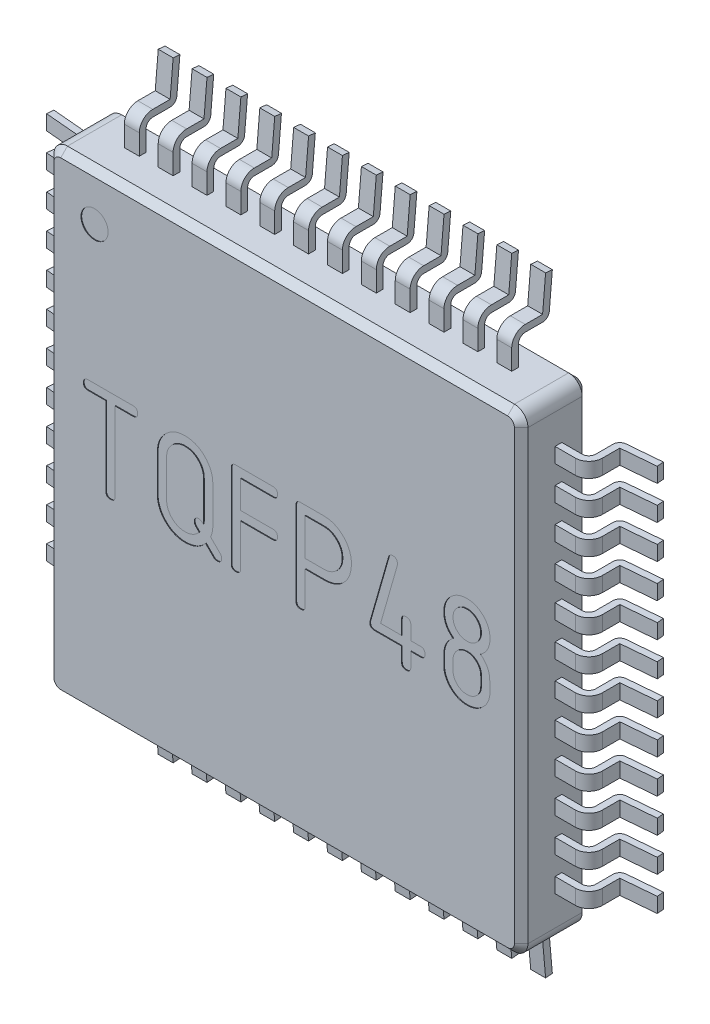
from build123d import *

# Parameters (mm, degrees)
EXTRUDE_1_DEPTH                  = 1
CHAMFER_1_SIZE                   = 0.1
EXTRUDE_2_DEPTH                  = 0.11
PATTERN_LINEAR_1_COUNT           = 12
PATTERN_LINEAR_1_PITCH           = 0.5
PATTERN_CIRCULAR_1_COUNT         = 4
PATTERN_CIRCULAR_1_COPY_1_DEPTH  = 0.11
PATTERN_CIRCULAR_1_COPY_2_DEPTH  = 0.11
PATTERN_CIRCULAR_1_COPY_3_DEPTH  = 0.11
PATTERN_CIRCULAR_1_COPY_4_DEPTH  = 0.11
PATTERN_CIRCULAR_1_COPY_5_DEPTH  = 0.11
PATTERN_CIRCULAR_1_COPY_6_DEPTH  = 0.11
PATTERN_CIRCULAR_1_COPY_7_DEPTH  = 0.11
PATTERN_CIRCULAR_1_COPY_8_DEPTH  = 0.11
PATTERN_CIRCULAR_1_COPY_9_DEPTH  = 0.11
PATTERN_CIRCULAR_1_COPY_10_DEPTH = 0.11
PATTERN_CIRCULAR_1_COPY_11_DEPTH = 0.11
PATTERN_CIRCULAR_1_COPY_12_DEPTH = 0.11
PATTERN_CIRCULAR_1_COPY_13_DEPTH = 0.11
PATTERN_CIRCULAR_1_COPY_14_DEPTH = 0.11
PATTERN_CIRCULAR_1_COPY_15_DEPTH = 0.11
PATTERN_CIRCULAR_1_COPY_16_DEPTH = 0.11
PATTERN_CIRCULAR_1_COPY_17_DEPTH = 0.11
PATTERN_CIRCULAR_1_COPY_18_DEPTH = 0.11
PATTERN_CIRCULAR_1_COPY_19_DEPTH = 0.11
PATTERN_CIRCULAR_1_COPY_20_DEPTH = 0.11
PATTERN_CIRCULAR_1_COPY_21_DEPTH = 0.11
PATTERN_CIRCULAR_1_COPY_22_DEPTH = 0.11
PATTERN_CIRCULAR_1_COPY_23_DEPTH = 0.11
PATTERN_CIRCULAR_1_COPY_24_DEPTH = 0.11
PATTERN_CIRCULAR_1_COPY_25_DEPTH = 0.11
PATTERN_CIRCULAR_1_COPY_26_DEPTH = 0.11
PATTERN_CIRCULAR_1_COPY_27_DEPTH = 0.11
PATTERN_CIRCULAR_1_COPY_28_DEPTH = 0.11
PATTERN_CIRCULAR_1_COPY_29_DEPTH = 0.11
PATTERN_CIRCULAR_1_COPY_30_DEPTH = 0.11
PATTERN_CIRCULAR_1_COPY_31_DEPTH = 0.11
PATTERN_CIRCULAR_1_COPY_32_DEPTH = 0.11
PATTERN_CIRCULAR_1_COPY_33_DEPTH = 0.11
SKETCH_4_R                       = 0.2
CUT_EXTRUDE_1_DEPTH              = 0.01


with BuildPart() as part:
    # Эскиз2 → Бобышка-Вытянуть1 (new body)
    with BuildSketch(Plane.XY.offset(0.1)):
        with BuildLine():
            Line((-3.3, 3.5), (3.3, 3.5))
            ThreePointArc((3.3, 3.5), (3.441421356, 3.441421356), (3.5, 3.3))
            Line((3.5, 3.3), (3.5, -3.3))
            ThreePointArc((3.5, -3.3), (3.441421356, -3.441421356), (3.3, -3.5))
            Line((3.3, -3.5), (-3.3, -3.5))
            ThreePointArc((-3.3, -3.5), (-3.441421356, -3.441421356), (-3.5, -3.3))
            Line((-3.5, -3.3), (-3.5, 3.3))
            ThreePointArc((-3.5, 3.3), (-3.441421356, 3.441421356), (-3.3, 3.5))
        make_face()
    extrude(amount=EXTRUDE_1_DEPTH)

    # Фаска1
    chamfer_1_edges = [part.edges().sort_by_distance(p)[0] for p in [
        (0, 3.5, 0.1),
        (-3.441421356, 3.441421356, 0.1),
        (3.441421356, 3.441421356, 0.1),
        (-3.5, 0, 0.1),
        (3.5, 0, 0.1),
        (-3.441421356, -3.441421356, 0.1),
        (3.441421356, -3.441421356, 0.1),
        (0, -3.5, 0.1),
        (0, 3.5, 1.1),
        (-3.441421356, 3.441421356, 1.1),
        (3.441421356, 3.441421356, 1.1),
        (-3.5, 0, 1.1),
        (3.5, 0, 1.1),
        (-3.441421356, -3.441421356, 1.1),
        (3.441421356, -3.441421356, 1.1),
        (0, -3.5, 1.1),
    ]]
    chamfer(chamfer_1_edges, length=CHAMFER_1_SIZE)

    # Эскиз3 → Бобышка-Вытянуть2 (add, symmetric)
    with BuildSketch(Plane(origin=(0, 2.75, 0), x_dir=(-1, 0, 0), z_dir=(0, 1, 0))):
        with BuildLine():
            Line((3.5, 0.5), (3.8, 0.5))
            ThreePointArc((3.8, 0.5), (3.870710678, 0.470710678), (3.9, 0.4))
            Line((3.9, 0.4), (3.9, 0.144126316))
            ThreePointArc((3.9, 0.144126316), (3.926272266, 0.076567295), (3.991284426, 0.044506846))
            Line((3.991284426, 0.044506846), (4.5, 0))
            Line((4.5, 0), (4.508715574, 0.09961947))
            Line((4.508715574, 0.09961947), (4, 0.144126316))
            Line((4, 0.144126316), (4, 0.4))
            ThreePointArc((4, 0.4), (3.941421356, 0.541421356), (3.8, 0.6))
            Line((3.8, 0.6), (3.5, 0.6))
            Line((3.5, 0.6), (3.5, 0.5))
        make_face()
    extrude_2 = extrude(amount=EXTRUDE_2_DEPTH, both=True)

    # Линейный массив1: Бобышка-Вытянуть2 ×12
    with Locations(*[(0, -i * PATTERN_LINEAR_1_PITCH, 0) for i in range(1, PATTERN_LINEAR_1_COUNT)]):
        add(extrude_2)

    # Круговой массив1: Бобышка-Вытянуть2 ×4 about axis
    pattern_circular_1_axis = Axis((0, 0, -0.055), (0, 0, 1))
    for i in range(1, PATTERN_CIRCULAR_1_COUNT):
        add(extrude_2.rotate(pattern_circular_1_axis, i * 360 / PATTERN_CIRCULAR_1_COUNT))

    # Круговой массив1 copy 1 sketch → Круговой массив1 copy 1 (add, symmetric)
    with BuildSketch(Plane(origin=(-2.25, 0, 0), x_dir=(0, -1, 0), z_dir=(-1, 0, 0))):
        with BuildLine():
            Line((3.5, 0.5), (3.8, 0.5))
            ThreePointArc((3.8, 0.5), (3.870710678, 0.470710678), (3.9, 0.4))
            Line((3.9, 0.4), (3.9, 0.144126316))
            ThreePointArc((3.9, 0.144126316), (3.926272266, 0.076567295), (3.991284426, 0.044506846))
            Line((3.991284426, 0.044506846), (4.5, 0))
            Line((4.5, 0), (4.508715574, 0.09961947))
            Line((4.508715574, 0.09961947), (4, 0.144126316))
            Line((4, 0.144126316), (4, 0.4))
            ThreePointArc((4, 0.4), (3.941421356, 0.541421356), (3.8, 0.6))
            Line((3.8, 0.6), (3.5, 0.6))
            Line((3.5, 0.6), (3.5, 0.5))
        make_face()
    extrude(amount=PATTERN_CIRCULAR_1_COPY_1_DEPTH, both=True)

    # Круговой массив1 copy 2 sketch → Круговой массив1 copy 2 (add, symmetric)
    with BuildSketch(Plane.XZ.offset(2.25)):
        with BuildLine():
            Line((3.5, 0.5), (3.8, 0.5))
            ThreePointArc((3.8, 0.5), (3.870710678, 0.470710678), (3.9, 0.4))
            Line((3.9, 0.4), (3.9, 0.144126316))
            ThreePointArc((3.9, 0.144126316), (3.926272266, 0.076567295), (3.991284426, 0.044506846))
            Line((3.991284426, 0.044506846), (4.5, 0))
            Line((4.5, 0), (4.508715574, 0.09961947))
            Line((4.508715574, 0.09961947), (4, 0.144126316))
            Line((4, 0.144126316), (4, 0.4))
            ThreePointArc((4, 0.4), (3.941421356, 0.541421356), (3.8, 0.6))
            Line((3.8, 0.6), (3.5, 0.6))
            Line((3.5, 0.6), (3.5, 0.5))
        make_face()
    extrude(amount=PATTERN_CIRCULAR_1_COPY_2_DEPTH, both=True)

    # Круговой массив1 copy 3 sketch → Круговой массив1 copy 3 (add, symmetric)
    with BuildSketch(Plane.YZ.offset(2.25)):
        with BuildLine():
            Line((3.5, 0.5), (3.8, 0.5))
            ThreePointArc((3.8, 0.5), (3.870710678, 0.470710678), (3.9, 0.4))
            Line((3.9, 0.4), (3.9, 0.144126316))
            ThreePointArc((3.9, 0.144126316), (3.926272266, 0.076567295), (3.991284426, 0.044506846))
            Line((3.991284426, 0.044506846), (4.5, 0))
            Line((4.5, 0), (4.508715574, 0.09961947))
            Line((4.508715574, 0.09961947), (4, 0.144126316))
            Line((4, 0.144126316), (4, 0.4))
            ThreePointArc((4, 0.4), (3.941421356, 0.541421356), (3.8, 0.6))
            Line((3.8, 0.6), (3.5, 0.6))
            Line((3.5, 0.6), (3.5, 0.5))
        make_face()
    extrude(amount=PATTERN_CIRCULAR_1_COPY_3_DEPTH, both=True)

    # Круговой массив1 copy 4 sketch → Круговой массив1 copy 4 (add, symmetric)
    with BuildSketch(Plane(origin=(-1.75, 0, 0), x_dir=(0, -1, 0), z_dir=(-1, 0, 0))):
        with BuildLine():
            Line((3.5, 0.5), (3.8, 0.5))
            ThreePointArc((3.8, 0.5), (3.870710678, 0.470710678), (3.9, 0.4))
            Line((3.9, 0.4), (3.9, 0.144126316))
            ThreePointArc((3.9, 0.144126316), (3.926272266, 0.076567295), (3.991284426, 0.044506846))
            Line((3.991284426, 0.044506846), (4.5, 0))
            Line((4.5, 0), (4.508715574, 0.09961947))
            Line((4.508715574, 0.09961947), (4, 0.144126316))
            Line((4, 0.144126316), (4, 0.4))
            ThreePointArc((4, 0.4), (3.941421356, 0.541421356), (3.8, 0.6))
            Line((3.8, 0.6), (3.5, 0.6))
            Line((3.5, 0.6), (3.5, 0.5))
        make_face()
    extrude(amount=PATTERN_CIRCULAR_1_COPY_4_DEPTH, both=True)

    # Круговой массив1 copy 5 sketch → Круговой массив1 copy 5 (add, symmetric)
    with BuildSketch(Plane.XZ.offset(1.75)):
        with BuildLine():
            Line((3.5, 0.5), (3.8, 0.5))
            ThreePointArc((3.8, 0.5), (3.870710678, 0.470710678), (3.9, 0.4))
            Line((3.9, 0.4), (3.9, 0.144126316))
            ThreePointArc((3.9, 0.144126316), (3.926272266, 0.076567295), (3.991284426, 0.044506846))
            Line((3.991284426, 0.044506846), (4.5, 0))
            Line((4.5, 0), (4.508715574, 0.09961947))
            Line((4.508715574, 0.09961947), (4, 0.144126316))
            Line((4, 0.144126316), (4, 0.4))
            ThreePointArc((4, 0.4), (3.941421356, 0.541421356), (3.8, 0.6))
            Line((3.8, 0.6), (3.5, 0.6))
            Line((3.5, 0.6), (3.5, 0.5))
        make_face()
    extrude(amount=PATTERN_CIRCULAR_1_COPY_5_DEPTH, both=True)

    # Круговой массив1 copy 6 sketch → Круговой массив1 copy 6 (add, symmetric)
    with BuildSketch(Plane.YZ.offset(1.75)):
        with BuildLine():
            Line((3.5, 0.5), (3.8, 0.5))
            ThreePointArc((3.8, 0.5), (3.870710678, 0.470710678), (3.9, 0.4))
            Line((3.9, 0.4), (3.9, 0.144126316))
            ThreePointArc((3.9, 0.144126316), (3.926272266, 0.076567295), (3.991284426, 0.044506846))
            Line((3.991284426, 0.044506846), (4.5, 0))
            Line((4.5, 0), (4.508715574, 0.09961947))
            Line((4.508715574, 0.09961947), (4, 0.144126316))
            Line((4, 0.144126316), (4, 0.4))
            ThreePointArc((4, 0.4), (3.941421356, 0.541421356), (3.8, 0.6))
            Line((3.8, 0.6), (3.5, 0.6))
            Line((3.5, 0.6), (3.5, 0.5))
        make_face()
    extrude(amount=PATTERN_CIRCULAR_1_COPY_6_DEPTH, both=True)

    # Круговой массив1 copy 7 sketch → Круговой массив1 copy 7 (add, symmetric)
    with BuildSketch(Plane(origin=(-1.25, 0, 0), x_dir=(0, -1, 0), z_dir=(-1, 0, 0))):
        with BuildLine():
            Line((3.5, 0.5), (3.8, 0.5))
            ThreePointArc((3.8, 0.5), (3.870710678, 0.470710678), (3.9, 0.4))
            Line((3.9, 0.4), (3.9, 0.144126316))
            ThreePointArc((3.9, 0.144126316), (3.926272266, 0.076567295), (3.991284426, 0.044506846))
            Line((3.991284426, 0.044506846), (4.5, 0))
            Line((4.5, 0), (4.508715574, 0.09961947))
            Line((4.508715574, 0.09961947), (4, 0.144126316))
            Line((4, 0.144126316), (4, 0.4))
            ThreePointArc((4, 0.4), (3.941421356, 0.541421356), (3.8, 0.6))
            Line((3.8, 0.6), (3.5, 0.6))
            Line((3.5, 0.6), (3.5, 0.5))
        make_face()
    extrude(amount=PATTERN_CIRCULAR_1_COPY_7_DEPTH, both=True)

    # Круговой массив1 copy 8 sketch → Круговой массив1 copy 8 (add, symmetric)
    with BuildSketch(Plane.XZ.offset(1.25)):
        with BuildLine():
            Line((3.5, 0.5), (3.8, 0.5))
            ThreePointArc((3.8, 0.5), (3.870710678, 0.470710678), (3.9, 0.4))
            Line((3.9, 0.4), (3.9, 0.144126316))
            ThreePointArc((3.9, 0.144126316), (3.926272266, 0.076567295), (3.991284426, 0.044506846))
            Line((3.991284426, 0.044506846), (4.5, 0))
            Line((4.5, 0), (4.508715574, 0.09961947))
            Line((4.508715574, 0.09961947), (4, 0.144126316))
            Line((4, 0.144126316), (4, 0.4))
            ThreePointArc((4, 0.4), (3.941421356, 0.541421356), (3.8, 0.6))
            Line((3.8, 0.6), (3.5, 0.6))
            Line((3.5, 0.6), (3.5, 0.5))
        make_face()
    extrude(amount=PATTERN_CIRCULAR_1_COPY_8_DEPTH, both=True)

    # Круговой массив1 copy 9 sketch → Круговой массив1 copy 9 (add, symmetric)
    with BuildSketch(Plane.YZ.offset(1.25)):
        with BuildLine():
            Line((3.5, 0.5), (3.8, 0.5))
            ThreePointArc((3.8, 0.5), (3.870710678, 0.470710678), (3.9, 0.4))
            Line((3.9, 0.4), (3.9, 0.144126316))
            ThreePointArc((3.9, 0.144126316), (3.926272266, 0.076567295), (3.991284426, 0.044506846))
            Line((3.991284426, 0.044506846), (4.5, 0))
            Line((4.5, 0), (4.508715574, 0.09961947))
            Line((4.508715574, 0.09961947), (4, 0.144126316))
            Line((4, 0.144126316), (4, 0.4))
            ThreePointArc((4, 0.4), (3.941421356, 0.541421356), (3.8, 0.6))
            Line((3.8, 0.6), (3.5, 0.6))
            Line((3.5, 0.6), (3.5, 0.5))
        make_face()
    extrude(amount=PATTERN_CIRCULAR_1_COPY_9_DEPTH, both=True)

    # Круговой массив1 copy 10 sketch → Круговой массив1 copy 10 (add, symmetric)
    with BuildSketch(Plane(origin=(-0.75, 0, 0), x_dir=(0, -1, 0), z_dir=(-1, 0, 0))):
        with BuildLine():
            Line((3.5, 0.5), (3.8, 0.5))
            ThreePointArc((3.8, 0.5), (3.870710678, 0.470710678), (3.9, 0.4))
            Line((3.9, 0.4), (3.9, 0.144126316))
            ThreePointArc((3.9, 0.144126316), (3.926272266, 0.076567295), (3.991284426, 0.044506846))
            Line((3.991284426, 0.044506846), (4.5, 0))
            Line((4.5, 0), (4.508715574, 0.09961947))
            Line((4.508715574, 0.09961947), (4, 0.144126316))
            Line((4, 0.144126316), (4, 0.4))
            ThreePointArc((4, 0.4), (3.941421356, 0.541421356), (3.8, 0.6))
            Line((3.8, 0.6), (3.5, 0.6))
            Line((3.5, 0.6), (3.5, 0.5))
        make_face()
    extrude(amount=PATTERN_CIRCULAR_1_COPY_10_DEPTH, both=True)

    # Круговой массив1 copy 11 sketch → Круговой массив1 copy 11 (add, symmetric)
    with BuildSketch(Plane.XZ.offset(0.75)):
        with BuildLine():
            Line((3.5, 0.5), (3.8, 0.5))
            ThreePointArc((3.8, 0.5), (3.870710678, 0.470710678), (3.9, 0.4))
            Line((3.9, 0.4), (3.9, 0.144126316))
            ThreePointArc((3.9, 0.144126316), (3.926272266, 0.076567295), (3.991284426, 0.044506846))
            Line((3.991284426, 0.044506846), (4.5, 0))
            Line((4.5, 0), (4.508715574, 0.09961947))
            Line((4.508715574, 0.09961947), (4, 0.144126316))
            Line((4, 0.144126316), (4, 0.4))
            ThreePointArc((4, 0.4), (3.941421356, 0.541421356), (3.8, 0.6))
            Line((3.8, 0.6), (3.5, 0.6))
            Line((3.5, 0.6), (3.5, 0.5))
        make_face()
    extrude(amount=PATTERN_CIRCULAR_1_COPY_11_DEPTH, both=True)

    # Круговой массив1 copy 12 sketch → Круговой массив1 copy 12 (add, symmetric)
    with BuildSketch(Plane.YZ.offset(0.75)):
        with BuildLine():
            Line((3.5, 0.5), (3.8, 0.5))
            ThreePointArc((3.8, 0.5), (3.870710678, 0.470710678), (3.9, 0.4))
            Line((3.9, 0.4), (3.9, 0.144126316))
            ThreePointArc((3.9, 0.144126316), (3.926272266, 0.076567295), (3.991284426, 0.044506846))
            Line((3.991284426, 0.044506846), (4.5, 0))
            Line((4.5, 0), (4.508715574, 0.09961947))
            Line((4.508715574, 0.09961947), (4, 0.144126316))
            Line((4, 0.144126316), (4, 0.4))
            ThreePointArc((4, 0.4), (3.941421356, 0.541421356), (3.8, 0.6))
            Line((3.8, 0.6), (3.5, 0.6))
            Line((3.5, 0.6), (3.5, 0.5))
        make_face()
    extrude(amount=PATTERN_CIRCULAR_1_COPY_12_DEPTH, both=True)

    # Круговой массив1 copy 13 sketch → Круговой массив1 copy 13 (add, symmetric)
    with BuildSketch(Plane(origin=(-0.25, 0, 0), x_dir=(0, -1, 0), z_dir=(-1, 0, 0))):
        with BuildLine():
            Line((3.5, 0.5), (3.8, 0.5))
            ThreePointArc((3.8, 0.5), (3.870710678, 0.470710678), (3.9, 0.4))
            Line((3.9, 0.4), (3.9, 0.144126316))
            ThreePointArc((3.9, 0.144126316), (3.926272266, 0.076567295), (3.991284426, 0.044506846))
            Line((3.991284426, 0.044506846), (4.5, 0))
            Line((4.5, 0), (4.508715574, 0.09961947))
            Line((4.508715574, 0.09961947), (4, 0.144126316))
            Line((4, 0.144126316), (4, 0.4))
            ThreePointArc((4, 0.4), (3.941421356, 0.541421356), (3.8, 0.6))
            Line((3.8, 0.6), (3.5, 0.6))
            Line((3.5, 0.6), (3.5, 0.5))
        make_face()
    extrude(amount=PATTERN_CIRCULAR_1_COPY_13_DEPTH, both=True)

    # Круговой массив1 copy 14 sketch → Круговой массив1 copy 14 (add, symmetric)
    with BuildSketch(Plane.XZ.offset(0.25)):
        with BuildLine():
            Line((3.5, 0.5), (3.8, 0.5))
            ThreePointArc((3.8, 0.5), (3.870710678, 0.470710678), (3.9, 0.4))
            Line((3.9, 0.4), (3.9, 0.144126316))
            ThreePointArc((3.9, 0.144126316), (3.926272266, 0.076567295), (3.991284426, 0.044506846))
            Line((3.991284426, 0.044506846), (4.5, 0))
            Line((4.5, 0), (4.508715574, 0.09961947))
            Line((4.508715574, 0.09961947), (4, 0.144126316))
            Line((4, 0.144126316), (4, 0.4))
            ThreePointArc((4, 0.4), (3.941421356, 0.541421356), (3.8, 0.6))
            Line((3.8, 0.6), (3.5, 0.6))
            Line((3.5, 0.6), (3.5, 0.5))
        make_face()
    extrude(amount=PATTERN_CIRCULAR_1_COPY_14_DEPTH, both=True)

    # Круговой массив1 copy 15 sketch → Круговой массив1 copy 15 (add, symmetric)
    with BuildSketch(Plane.YZ.offset(0.25)):
        with BuildLine():
            Line((3.5, 0.5), (3.8, 0.5))
            ThreePointArc((3.8, 0.5), (3.870710678, 0.470710678), (3.9, 0.4))
            Line((3.9, 0.4), (3.9, 0.144126316))
            ThreePointArc((3.9, 0.144126316), (3.926272266, 0.076567295), (3.991284426, 0.044506846))
            Line((3.991284426, 0.044506846), (4.5, 0))
            Line((4.5, 0), (4.508715574, 0.09961947))
            Line((4.508715574, 0.09961947), (4, 0.144126316))
            Line((4, 0.144126316), (4, 0.4))
            ThreePointArc((4, 0.4), (3.941421356, 0.541421356), (3.8, 0.6))
            Line((3.8, 0.6), (3.5, 0.6))
            Line((3.5, 0.6), (3.5, 0.5))
        make_face()
    extrude(amount=PATTERN_CIRCULAR_1_COPY_15_DEPTH, both=True)

    # Круговой массив1 copy 16 sketch → Круговой массив1 copy 16 (add, symmetric)
    with BuildSketch(Plane(origin=(0.25, 0, 0), x_dir=(0, -1, 0), z_dir=(-1, 0, 0))):
        with BuildLine():
            Line((3.5, 0.5), (3.8, 0.5))
            ThreePointArc((3.8, 0.5), (3.870710678, 0.470710678), (3.9, 0.4))
            Line((3.9, 0.4), (3.9, 0.144126316))
            ThreePointArc((3.9, 0.144126316), (3.926272266, 0.076567295), (3.991284426, 0.044506846))
            Line((3.991284426, 0.044506846), (4.5, 0))
            Line((4.5, 0), (4.508715574, 0.09961947))
            Line((4.508715574, 0.09961947), (4, 0.144126316))
            Line((4, 0.144126316), (4, 0.4))
            ThreePointArc((4, 0.4), (3.941421356, 0.541421356), (3.8, 0.6))
            Line((3.8, 0.6), (3.5, 0.6))
            Line((3.5, 0.6), (3.5, 0.5))
        make_face()
    extrude(amount=PATTERN_CIRCULAR_1_COPY_16_DEPTH, both=True)

    # Круговой массив1 copy 17 sketch → Круговой массив1 copy 17 (add, symmetric)
    with BuildSketch(Plane.XZ.offset(-0.25)):
        with BuildLine():
            Line((3.5, 0.5), (3.8, 0.5))
            ThreePointArc((3.8, 0.5), (3.870710678, 0.470710678), (3.9, 0.4))
            Line((3.9, 0.4), (3.9, 0.144126316))
            ThreePointArc((3.9, 0.144126316), (3.926272266, 0.076567295), (3.991284426, 0.044506846))
            Line((3.991284426, 0.044506846), (4.5, 0))
            Line((4.5, 0), (4.508715574, 0.09961947))
            Line((4.508715574, 0.09961947), (4, 0.144126316))
            Line((4, 0.144126316), (4, 0.4))
            ThreePointArc((4, 0.4), (3.941421356, 0.541421356), (3.8, 0.6))
            Line((3.8, 0.6), (3.5, 0.6))
            Line((3.5, 0.6), (3.5, 0.5))
        make_face()
    extrude(amount=PATTERN_CIRCULAR_1_COPY_17_DEPTH, both=True)

    # Круговой массив1 copy 18 sketch → Круговой массив1 copy 18 (add, symmetric)
    with BuildSketch(Plane.YZ.offset(-0.25)):
        with BuildLine():
            Line((3.5, 0.5), (3.8, 0.5))
            ThreePointArc((3.8, 0.5), (3.870710678, 0.470710678), (3.9, 0.4))
            Line((3.9, 0.4), (3.9, 0.144126316))
            ThreePointArc((3.9, 0.144126316), (3.926272266, 0.076567295), (3.991284426, 0.044506846))
            Line((3.991284426, 0.044506846), (4.5, 0))
            Line((4.5, 0), (4.508715574, 0.09961947))
            Line((4.508715574, 0.09961947), (4, 0.144126316))
            Line((4, 0.144126316), (4, 0.4))
            ThreePointArc((4, 0.4), (3.941421356, 0.541421356), (3.8, 0.6))
            Line((3.8, 0.6), (3.5, 0.6))
            Line((3.5, 0.6), (3.5, 0.5))
        make_face()
    extrude(amount=PATTERN_CIRCULAR_1_COPY_18_DEPTH, both=True)

    # Круговой массив1 copy 19 sketch → Круговой массив1 copy 19 (add, symmetric)
    with BuildSketch(Plane(origin=(0.75, 0, 0), x_dir=(0, -1, 0), z_dir=(-1, 0, 0))):
        with BuildLine():
            Line((3.5, 0.5), (3.8, 0.5))
            ThreePointArc((3.8, 0.5), (3.870710678, 0.470710678), (3.9, 0.4))
            Line((3.9, 0.4), (3.9, 0.144126316))
            ThreePointArc((3.9, 0.144126316), (3.926272266, 0.076567295), (3.991284426, 0.044506846))
            Line((3.991284426, 0.044506846), (4.5, 0))
            Line((4.5, 0), (4.508715574, 0.09961947))
            Line((4.508715574, 0.09961947), (4, 0.144126316))
            Line((4, 0.144126316), (4, 0.4))
            ThreePointArc((4, 0.4), (3.941421356, 0.541421356), (3.8, 0.6))
            Line((3.8, 0.6), (3.5, 0.6))
            Line((3.5, 0.6), (3.5, 0.5))
        make_face()
    extrude(amount=PATTERN_CIRCULAR_1_COPY_19_DEPTH, both=True)

    # Круговой массив1 copy 20 sketch → Круговой массив1 copy 20 (add, symmetric)
    with BuildSketch(Plane.XZ.offset(-0.75)):
        with BuildLine():
            Line((3.5, 0.5), (3.8, 0.5))
            ThreePointArc((3.8, 0.5), (3.870710678, 0.470710678), (3.9, 0.4))
            Line((3.9, 0.4), (3.9, 0.144126316))
            ThreePointArc((3.9, 0.144126316), (3.926272266, 0.076567295), (3.991284426, 0.044506846))
            Line((3.991284426, 0.044506846), (4.5, 0))
            Line((4.5, 0), (4.508715574, 0.09961947))
            Line((4.508715574, 0.09961947), (4, 0.144126316))
            Line((4, 0.144126316), (4, 0.4))
            ThreePointArc((4, 0.4), (3.941421356, 0.541421356), (3.8, 0.6))
            Line((3.8, 0.6), (3.5, 0.6))
            Line((3.5, 0.6), (3.5, 0.5))
        make_face()
    extrude(amount=PATTERN_CIRCULAR_1_COPY_20_DEPTH, both=True)

    # Круговой массив1 copy 21 sketch → Круговой массив1 copy 21 (add, symmetric)
    with BuildSketch(Plane.YZ.offset(-0.75)):
        with BuildLine():
            Line((3.5, 0.5), (3.8, 0.5))
            ThreePointArc((3.8, 0.5), (3.870710678, 0.470710678), (3.9, 0.4))
            Line((3.9, 0.4), (3.9, 0.144126316))
            ThreePointArc((3.9, 0.144126316), (3.926272266, 0.076567295), (3.991284426, 0.044506846))
            Line((3.991284426, 0.044506846), (4.5, 0))
            Line((4.5, 0), (4.508715574, 0.09961947))
            Line((4.508715574, 0.09961947), (4, 0.144126316))
            Line((4, 0.144126316), (4, 0.4))
            ThreePointArc((4, 0.4), (3.941421356, 0.541421356), (3.8, 0.6))
            Line((3.8, 0.6), (3.5, 0.6))
            Line((3.5, 0.6), (3.5, 0.5))
        make_face()
    extrude(amount=PATTERN_CIRCULAR_1_COPY_21_DEPTH, both=True)

    # Круговой массив1 copy 22 sketch → Круговой массив1 copy 22 (add, symmetric)
    with BuildSketch(Plane(origin=(1.25, 0, 0), x_dir=(0, -1, 0), z_dir=(-1, 0, 0))):
        with BuildLine():
            Line((3.5, 0.5), (3.8, 0.5))
            ThreePointArc((3.8, 0.5), (3.870710678, 0.470710678), (3.9, 0.4))
            Line((3.9, 0.4), (3.9, 0.144126316))
            ThreePointArc((3.9, 0.144126316), (3.926272266, 0.076567295), (3.991284426, 0.044506846))
            Line((3.991284426, 0.044506846), (4.5, 0))
            Line((4.5, 0), (4.508715574, 0.09961947))
            Line((4.508715574, 0.09961947), (4, 0.144126316))
            Line((4, 0.144126316), (4, 0.4))
            ThreePointArc((4, 0.4), (3.941421356, 0.541421356), (3.8, 0.6))
            Line((3.8, 0.6), (3.5, 0.6))
            Line((3.5, 0.6), (3.5, 0.5))
        make_face()
    extrude(amount=PATTERN_CIRCULAR_1_COPY_22_DEPTH, both=True)

    # Круговой массив1 copy 23 sketch → Круговой массив1 copy 23 (add, symmetric)
    with BuildSketch(Plane.XZ.offset(-1.25)):
        with BuildLine():
            Line((3.5, 0.5), (3.8, 0.5))
            ThreePointArc((3.8, 0.5), (3.870710678, 0.470710678), (3.9, 0.4))
            Line((3.9, 0.4), (3.9, 0.144126316))
            ThreePointArc((3.9, 0.144126316), (3.926272266, 0.076567295), (3.991284426, 0.044506846))
            Line((3.991284426, 0.044506846), (4.5, 0))
            Line((4.5, 0), (4.508715574, 0.09961947))
            Line((4.508715574, 0.09961947), (4, 0.144126316))
            Line((4, 0.144126316), (4, 0.4))
            ThreePointArc((4, 0.4), (3.941421356, 0.541421356), (3.8, 0.6))
            Line((3.8, 0.6), (3.5, 0.6))
            Line((3.5, 0.6), (3.5, 0.5))
        make_face()
    extrude(amount=PATTERN_CIRCULAR_1_COPY_23_DEPTH, both=True)

    # Круговой массив1 copy 24 sketch → Круговой массив1 copy 24 (add, symmetric)
    with BuildSketch(Plane.YZ.offset(-1.25)):
        with BuildLine():
            Line((3.5, 0.5), (3.8, 0.5))
            ThreePointArc((3.8, 0.5), (3.870710678, 0.470710678), (3.9, 0.4))
            Line((3.9, 0.4), (3.9, 0.144126316))
            ThreePointArc((3.9, 0.144126316), (3.926272266, 0.076567295), (3.991284426, 0.044506846))
            Line((3.991284426, 0.044506846), (4.5, 0))
            Line((4.5, 0), (4.508715574, 0.09961947))
            Line((4.508715574, 0.09961947), (4, 0.144126316))
            Line((4, 0.144126316), (4, 0.4))
            ThreePointArc((4, 0.4), (3.941421356, 0.541421356), (3.8, 0.6))
            Line((3.8, 0.6), (3.5, 0.6))
            Line((3.5, 0.6), (3.5, 0.5))
        make_face()
    extrude(amount=PATTERN_CIRCULAR_1_COPY_24_DEPTH, both=True)

    # Круговой массив1 copy 25 sketch → Круговой массив1 copy 25 (add, symmetric)
    with BuildSketch(Plane(origin=(1.75, 0, 0), x_dir=(0, -1, 0), z_dir=(-1, 0, 0))):
        with BuildLine():
            Line((3.5, 0.5), (3.8, 0.5))
            ThreePointArc((3.8, 0.5), (3.870710678, 0.470710678), (3.9, 0.4))
            Line((3.9, 0.4), (3.9, 0.144126316))
            ThreePointArc((3.9, 0.144126316), (3.926272266, 0.076567295), (3.991284426, 0.044506846))
            Line((3.991284426, 0.044506846), (4.5, 0))
            Line((4.5, 0), (4.508715574, 0.09961947))
            Line((4.508715574, 0.09961947), (4, 0.144126316))
            Line((4, 0.144126316), (4, 0.4))
            ThreePointArc((4, 0.4), (3.941421356, 0.541421356), (3.8, 0.6))
            Line((3.8, 0.6), (3.5, 0.6))
            Line((3.5, 0.6), (3.5, 0.5))
        make_face()
    extrude(amount=PATTERN_CIRCULAR_1_COPY_25_DEPTH, both=True)

    # Круговой массив1 copy 26 sketch → Круговой массив1 copy 26 (add, symmetric)
    with BuildSketch(Plane.XZ.offset(-1.75)):
        with BuildLine():
            Line((3.5, 0.5), (3.8, 0.5))
            ThreePointArc((3.8, 0.5), (3.870710678, 0.470710678), (3.9, 0.4))
            Line((3.9, 0.4), (3.9, 0.144126316))
            ThreePointArc((3.9, 0.144126316), (3.926272266, 0.076567295), (3.991284426, 0.044506846))
            Line((3.991284426, 0.044506846), (4.5, 0))
            Line((4.5, 0), (4.508715574, 0.09961947))
            Line((4.508715574, 0.09961947), (4, 0.144126316))
            Line((4, 0.144126316), (4, 0.4))
            ThreePointArc((4, 0.4), (3.941421356, 0.541421356), (3.8, 0.6))
            Line((3.8, 0.6), (3.5, 0.6))
            Line((3.5, 0.6), (3.5, 0.5))
        make_face()
    extrude(amount=PATTERN_CIRCULAR_1_COPY_26_DEPTH, both=True)

    # Круговой массив1 copy 27 sketch → Круговой массив1 copy 27 (add, symmetric)
    with BuildSketch(Plane.YZ.offset(-1.75)):
        with BuildLine():
            Line((3.5, 0.5), (3.8, 0.5))
            ThreePointArc((3.8, 0.5), (3.870710678, 0.470710678), (3.9, 0.4))
            Line((3.9, 0.4), (3.9, 0.144126316))
            ThreePointArc((3.9, 0.144126316), (3.926272266, 0.076567295), (3.991284426, 0.044506846))
            Line((3.991284426, 0.044506846), (4.5, 0))
            Line((4.5, 0), (4.508715574, 0.09961947))
            Line((4.508715574, 0.09961947), (4, 0.144126316))
            Line((4, 0.144126316), (4, 0.4))
            ThreePointArc((4, 0.4), (3.941421356, 0.541421356), (3.8, 0.6))
            Line((3.8, 0.6), (3.5, 0.6))
            Line((3.5, 0.6), (3.5, 0.5))
        make_face()
    extrude(amount=PATTERN_CIRCULAR_1_COPY_27_DEPTH, both=True)

    # Круговой массив1 copy 28 sketch → Круговой массив1 copy 28 (add, symmetric)
    with BuildSketch(Plane(origin=(2.25, 0, 0), x_dir=(0, -1, 0), z_dir=(-1, 0, 0))):
        with BuildLine():
            Line((3.5, 0.5), (3.8, 0.5))
            ThreePointArc((3.8, 0.5), (3.870710678, 0.470710678), (3.9, 0.4))
            Line((3.9, 0.4), (3.9, 0.144126316))
            ThreePointArc((3.9, 0.144126316), (3.926272266, 0.076567295), (3.991284426, 0.044506846))
            Line((3.991284426, 0.044506846), (4.5, 0))
            Line((4.5, 0), (4.508715574, 0.09961947))
            Line((4.508715574, 0.09961947), (4, 0.144126316))
            Line((4, 0.144126316), (4, 0.4))
            ThreePointArc((4, 0.4), (3.941421356, 0.541421356), (3.8, 0.6))
            Line((3.8, 0.6), (3.5, 0.6))
            Line((3.5, 0.6), (3.5, 0.5))
        make_face()
    extrude(amount=PATTERN_CIRCULAR_1_COPY_28_DEPTH, both=True)

    # Круговой массив1 copy 29 sketch → Круговой массив1 copy 29 (add, symmetric)
    with BuildSketch(Plane.XZ.offset(-2.25)):
        with BuildLine():
            Line((3.5, 0.5), (3.8, 0.5))
            ThreePointArc((3.8, 0.5), (3.870710678, 0.470710678), (3.9, 0.4))
            Line((3.9, 0.4), (3.9, 0.144126316))
            ThreePointArc((3.9, 0.144126316), (3.926272266, 0.076567295), (3.991284426, 0.044506846))
            Line((3.991284426, 0.044506846), (4.5, 0))
            Line((4.5, 0), (4.508715574, 0.09961947))
            Line((4.508715574, 0.09961947), (4, 0.144126316))
            Line((4, 0.144126316), (4, 0.4))
            ThreePointArc((4, 0.4), (3.941421356, 0.541421356), (3.8, 0.6))
            Line((3.8, 0.6), (3.5, 0.6))
            Line((3.5, 0.6), (3.5, 0.5))
        make_face()
    extrude(amount=PATTERN_CIRCULAR_1_COPY_29_DEPTH, both=True)

    # Круговой массив1 copy 30 sketch → Круговой массив1 copy 30 (add, symmetric)
    with BuildSketch(Plane.YZ.offset(-2.25)):
        with BuildLine():
            Line((3.5, 0.5), (3.8, 0.5))
            ThreePointArc((3.8, 0.5), (3.870710678, 0.470710678), (3.9, 0.4))
            Line((3.9, 0.4), (3.9, 0.144126316))
            ThreePointArc((3.9, 0.144126316), (3.926272266, 0.076567295), (3.991284426, 0.044506846))
            Line((3.991284426, 0.044506846), (4.5, 0))
            Line((4.5, 0), (4.508715574, 0.09961947))
            Line((4.508715574, 0.09961947), (4, 0.144126316))
            Line((4, 0.144126316), (4, 0.4))
            ThreePointArc((4, 0.4), (3.941421356, 0.541421356), (3.8, 0.6))
            Line((3.8, 0.6), (3.5, 0.6))
            Line((3.5, 0.6), (3.5, 0.5))
        make_face()
    extrude(amount=PATTERN_CIRCULAR_1_COPY_30_DEPTH, both=True)

    # Круговой массив1 copy 31 sketch → Круговой массив1 copy 31 (add, symmetric)
    with BuildSketch(Plane(origin=(2.75, 0, 0), x_dir=(0, -1, 0), z_dir=(-1, 0, 0))):
        with BuildLine():
            Line((3.5, 0.5), (3.8, 0.5))
            ThreePointArc((3.8, 0.5), (3.870710678, 0.470710678), (3.9, 0.4))
            Line((3.9, 0.4), (3.9, 0.144126316))
            ThreePointArc((3.9, 0.144126316), (3.926272266, 0.076567295), (3.991284426, 0.044506846))
            Line((3.991284426, 0.044506846), (4.5, 0))
            Line((4.5, 0), (4.508715574, 0.09961947))
            Line((4.508715574, 0.09961947), (4, 0.144126316))
            Line((4, 0.144126316), (4, 0.4))
            ThreePointArc((4, 0.4), (3.941421356, 0.541421356), (3.8, 0.6))
            Line((3.8, 0.6), (3.5, 0.6))
            Line((3.5, 0.6), (3.5, 0.5))
        make_face()
    extrude(amount=PATTERN_CIRCULAR_1_COPY_31_DEPTH, both=True)

    # Круговой массив1 copy 32 sketch → Круговой массив1 copy 32 (add, symmetric)
    with BuildSketch(Plane.XZ.offset(-2.75)):
        with BuildLine():
            Line((3.5, 0.5), (3.8, 0.5))
            ThreePointArc((3.8, 0.5), (3.870710678, 0.470710678), (3.9, 0.4))
            Line((3.9, 0.4), (3.9, 0.144126316))
            ThreePointArc((3.9, 0.144126316), (3.926272266, 0.076567295), (3.991284426, 0.044506846))
            Line((3.991284426, 0.044506846), (4.5, 0))
            Line((4.5, 0), (4.508715574, 0.09961947))
            Line((4.508715574, 0.09961947), (4, 0.144126316))
            Line((4, 0.144126316), (4, 0.4))
            ThreePointArc((4, 0.4), (3.941421356, 0.541421356), (3.8, 0.6))
            Line((3.8, 0.6), (3.5, 0.6))
            Line((3.5, 0.6), (3.5, 0.5))
        make_face()
    extrude(amount=PATTERN_CIRCULAR_1_COPY_32_DEPTH, both=True)

    # Круговой массив1 copy 33 sketch → Круговой массив1 copy 33 (add, symmetric)
    with BuildSketch(Plane.YZ.offset(-2.75)):
        with BuildLine():
            Line((3.5, 0.5), (3.8, 0.5))
            ThreePointArc((3.8, 0.5), (3.870710678, 0.470710678), (3.9, 0.4))
            Line((3.9, 0.4), (3.9, 0.144126316))
            ThreePointArc((3.9, 0.144126316), (3.926272266, 0.076567295), (3.991284426, 0.044506846))
            Line((3.991284426, 0.044506846), (4.5, 0))
            Line((4.5, 0), (4.508715574, 0.09961947))
            Line((4.508715574, 0.09961947), (4, 0.144126316))
            Line((4, 0.144126316), (4, 0.4))
            ThreePointArc((4, 0.4), (3.941421356, 0.541421356), (3.8, 0.6))
            Line((3.8, 0.6), (3.5, 0.6))
            Line((3.5, 0.6), (3.5, 0.5))
        make_face()
    extrude(amount=PATTERN_CIRCULAR_1_COPY_33_DEPTH, both=True)

    # Эскиз4 → Вырез-Вытянуть1 (cut)
    # profile 1 of 7: a face of its own
    with BuildSketch(Plane.XY.offset(1.1)):
        with Locations((-2.8, 2.8)):
            Circle(SKETCH_4_R)
    # profile 2 of 7: a face of its own
    with BuildSketch(Plane.XY.offset(1.1)):
        with BuildLine():
            add(Edge.make_bspline(
                [(-2.963574219, 0.696044922), (-2.963499556, 0.701454201), (-2.963359739, 0.711583935), (-2.959706908, 0.725607276), (-2.954827007, 0.737767671), (-2.947088481, 0.747551936), (-2.937604046, 0.755357852), (-2.925690402, 0.760522822), (-2.912002269, 0.763970293), (-2.902085023, 0.764158899), (-2.896883937, 0.764257812)],
                knots=[0, 0, 0, 0, 1.182571124, 2.214551965, 3.162306919, 4.035667748, 4.922840852, 5.829928053, 6.861908894, 8, 8, 8, 8], degree=3))
            Line((-2.896883937, 0.764257812), (-2.23119921, 0.764257812))
            add(Edge.make_bspline(
                [(-2.23119921, 0.764257812), (-2.225998125, 0.764158899), (-2.216080879, 0.763970293), (-2.202392745, 0.760522822), (-2.190479101, 0.755357852), (-2.180994666, 0.747551936), (-2.17325614, 0.737767671), (-2.168376239, 0.725607276), (-2.164723409, 0.711583935), (-2.164583591, 0.701454201), (-2.164508929, 0.696044922)],
                knots=[0, 0, 0, 0, 1.138091106, 2.170071947, 3.077159148, 3.964332252, 4.837693081, 5.785448035, 6.817428876, 8, 8, 8, 8], degree=3))
            add(Edge.make_bspline(
                [(-2.164508929, 0.696044922), (-2.16461301, 0.690746895), (-2.164811602, 0.680638014), (-2.168199576, 0.66659925), (-2.173509728, 0.654673554), (-2.180438751, 0.644415267), (-2.190461836, 0.637097944), (-2.202079332, 0.631480892), (-2.215944173, 0.628591162), (-2.225707207, 0.628095432), (-2.230894688, 0.627832031)],
                knots=[0, 0, 0, 0, 1.164100439, 2.221157785, 3.151547364, 4.032294591, 4.90849306, 5.848230839, 6.856681008, 8, 8, 8, 8], degree=3))
            Line((-2.230894688, 0.627832031), (-2.495828683, 0.627832031))
            Line((-2.495828683, 0.627832031), (-2.495828683, -0.531787109))
            add(Edge.make_bspline(
                [(-2.495828683, -0.531787109), (-2.495928294, -0.537088561), (-2.496118356, -0.547203977), (-2.499563506, -0.561198939), (-2.504736518, -0.573379218), (-2.512419091, -0.583224228), (-2.522407957, -0.590852025), (-2.534345958, -0.596326841), (-2.548578254, -0.599267683), (-2.558648587, -0.599744597), (-2.564041574, -0.6)],
                knots=[0, 0, 0, 0, 1.147825403, 2.190104258, 3.107486261, 4.002358969, 4.866307497, 5.812869616, 6.828721528, 8, 8, 8, 8], degree=3))
            add(Edge.make_bspline(
                [(-2.564041574, -0.6), (-2.569325484, -0.599719929), (-2.579378707, -0.599187063), (-2.593606427, -0.596480885), (-2.605426383, -0.59064299), (-2.615707934, -0.58345347), (-2.622897454, -0.573171919), (-2.628735349, -0.561351963), (-2.631441527, -0.547124243), (-2.631974393, -0.537071019), (-2.632254464, -0.531787109)],
                knots=[0, 0, 0, 0, 1.150813752, 2.189550435, 3.117366144, 4, 4.882633856, 5.810449565, 6.849186248, 8, 8, 8, 8], degree=3))
            Line((-2.632254464, -0.531787109), (-2.632254464, 0.627832031))
            Line((-2.632254464, 0.627832031), (-2.897188459, 0.627832031))
            add(Edge.make_bspline(
                [(-2.897188459, 0.627832031), (-2.902378118, 0.628092994), (-2.91214525, 0.628584134), (-2.925982734, 0.631504498), (-2.937619773, 0.636983845), (-2.947322918, 0.644622303), (-2.954632263, 0.654550842), (-2.959857597, 0.666620355), (-2.963279189, 0.680631803), (-2.963472766, 0.69074476), (-2.963574219, 0.696044922)],
                knots=[0, 0, 0, 0, 1.14393887, 2.152935795, 3.093183076, 3.952283899, 4.846743947, 5.77763796, 6.835268415, 8, 8, 8, 8], degree=3))
        make_face()
    # profile 3 of 7: a face of its own
    with BuildSketch(Plane.XY.offset(1.1)):
        with BuildLine():
            add(Edge.make_bspline(
                [(-1.160195923, -0.461138044), (-1.170197696, -0.472253357), (-1.189843272, -0.49408616), (-1.223271134, -0.522099026), (-1.258231905, -0.546481853), (-1.295758043, -0.565990186), (-1.335136658, -0.581394886), (-1.376793706, -0.591886148), (-1.420322842, -0.598925758), (-1.450173713, -0.599638296), (-1.4653268, -0.6)],
                knots=[0, 0, 0, 0, 1.034406248, 2.031790478, 3.012635843, 3.981159625, 4.953782538, 5.93422472, 6.951358134, 8, 8, 8, 8], degree=3))
            add(Edge.make_bspline(
                [(-1.4653268, -0.6), (-1.479156527, -0.599702973), (-1.506333311, -0.599119286), (-1.546242958, -0.592888213), (-1.584787025, -0.58400025), (-1.62181612, -0.570898562), (-1.656950393, -0.553444963), (-1.691030394, -0.533252296), (-1.723043289, -0.508433173), (-1.753560646, -0.480794077), (-1.781358345, -0.450345094), (-1.805548371, -0.417854067), (-1.826187954, -0.383854704), (-1.842860438, -0.34817081), (-1.856147532, -0.310981637), (-1.865543444, -0.272313709), (-1.871159889, -0.231998845), (-1.871827891, -0.204647254), (-1.872167969, -0.190722656)],
                knots=[0, 0, 0, 0, 1.033312615, 2.030561505, 3.013700211, 3.988422536, 4.959324787, 5.943459254, 6.945434469, 7.982448381, 9.019462293, 10.022931451, 11.007065918, 11.988386222, 12.963108547, 13.955405407, 14.959104204, 16, 16, 16, 16], degree=3))
            Line((-1.872167969, -0.190722656), (-1.872167969, 0.354980469))
            add(Edge.make_bspline(
                [(-1.872167969, 0.354980469), (-1.871871855, 0.368911895), (-1.871289907, 0.396291105), (-1.865044547, 0.436498851), (-1.856233107, 0.4752723), (-1.842980742, 0.512443171), (-1.825717057, 0.547774677), (-1.805313206, 0.581925923), (-1.780709523, 0.614197849), (-1.752958854, 0.644741217), (-1.722426554, 0.672520544), (-1.690041995, 0.697034679), (-1.656026417, 0.717951867), (-1.620404938, 0.734972783), (-1.5831919, 0.748341133), (-1.544406435, 0.757129436), (-1.504201935, 0.763381049), (-1.476822278, 0.763962136), (-1.462890625, 0.764257812)],
                knots=[0, 0, 0, 0, 1.037886018, 2.039740928, 3.027401155, 3.999305046, 4.97421019, 5.955499007, 6.96060772, 7.994623079, 9.028638438, 10.033747151, 11.018968421, 12.000694954, 12.972598845, 13.960259072, 14.962113982, 16, 16, 16, 16], degree=3))
            add(Edge.make_bspline(
                [(-1.462890625, 0.764257812), (-1.448961871, 0.76394563), (-1.421386839, 0.763327596), (-1.381042477, 0.757258971), (-1.342129955, 0.748197229), (-1.304881207, 0.735169331), (-1.269453951, 0.717692806), (-1.235099253, 0.697602947), (-1.203054632, 0.672676166), (-1.172501803, 0.645070659), (-1.144766058, 0.614498704), (-1.12018284, 0.582221352), (-1.099708241, 0.548155598), (-1.082765914, 0.512596211), (-1.069711542, 0.475311836), (-1.060188726, 0.436480643), (-1.05463108, 0.39594825), (-1.053956615, 0.368396503), (-1.053613281, 0.354371425)],
                knots=[0, 0, 0, 0, 1.036325472, 2.051634171, 3.03045615, 4.008022873, 4.981462168, 5.967753184, 6.965328966, 7.997789598, 9.030250231, 10.033847681, 11.013661049, 11.98383874, 12.961405463, 13.949345385, 14.956124537, 16, 16, 16, 16], degree=3))
            Line((-1.053613281, 0.354371425), (-1.053613281, -0.191940744))
            add(Edge.make_bspline(
                [(-1.053613281, -0.191940744), (-1.054044754, -0.20445193), (-1.05491266, -0.229618139), (-1.061354962, -0.267243131), (-1.071249545, -0.305089364), (-1.081147851, -0.329578004), (-1.086197117, -0.342070007)],
                knots=[0, 0, 0, 0, 0.970505138, 1.952167884, 2.955371787, 4, 4, 4, 4], degree=3))
            Line((-1.086197117, -0.342070007), (-0.945203509, -0.482759094))
            add(Edge.make_bspline(
                [(-0.945203509, -0.482759094), (-0.941843103, -0.486521727), (-0.93532734, -0.493817401), (-0.927628149, -0.506080737), (-0.923745773, -0.519483516), (-0.923026135, -0.528519545), (-0.922668893, -0.533005197)],
                knots=[0, 0, 0, 0, 1.071060325, 2.076765767, 3.045270919, 4, 4, 4, 4], degree=3))
            add(Edge.make_bspline(
                [(-0.922668893, -0.533005197), (-0.922745184, -0.538311598), (-0.922887906, -0.548238535), (-0.926511544, -0.561986621), (-0.931526274, -0.573844622), (-0.939069868, -0.583726459), (-0.949087887, -0.591054614), (-0.961063776, -0.596229641), (-0.974951532, -0.599739695), (-0.984970156, -0.59990991), (-0.99027274, -0.6)],
                knots=[0, 0, 0, 0, 1.162919306, 2.175528415, 3.104973992, 3.980283443, 4.873351745, 5.802797322, 6.837080694, 8, 8, 8, 8], degree=3))
            add(Edge.make_bspline(
                [(-0.99027274, -0.6), (-0.99528197, -0.599821462), (-1.004965954, -0.599476306), (-1.01866794, -0.595204019), (-1.031289792, -0.588857191), (-1.038212329, -0.582519396), (-1.04173693, -0.579292515)],
                knots=[0, 0, 0, 0, 1.051152796, 2.032117937, 2.998055438, 4, 4, 4, 4], degree=3))
            Line((-1.04173693, -0.579292515), (-1.160195923, -0.461138044))
        make_face()
        with BuildLine():
            add(Edge.make_bspline(
                [(-1.254597691, -0.365213667), (-1.262288201, -0.357677112), (-1.277773766, -0.342501552), (-1.293551785, -0.327630273), (-1.301494053, -0.320144435)],
                knots=[0, 0, 0, 0, 0.993248859, 2, 2, 2, 2], degree=3))
            add(Edge.make_bspline(
                [(-1.301494053, -0.320144435), (-1.305354689, -0.315507826), (-1.312744509, -0.306632677), (-1.320109667, -0.291747292), (-1.325641164, -0.277288661), (-1.326194823, -0.267408426), (-1.326464844, -0.262589809)],
                knots=[0, 0, 0, 0, 1.126404379, 2.156102701, 3.100726277, 4, 4, 4, 4], degree=3))
            add(Edge.make_bspline(
                [(-1.326464844, -0.262589809), (-1.326197842, -0.257301285), (-1.325694841, -0.247338322), (-1.322862869, -0.233265863), (-1.317168596, -0.221374597), (-1.309587077, -0.211474332), (-1.299649215, -0.203750606), (-1.28742795, -0.198794327), (-1.273271431, -0.195237406), (-1.26304889, -0.195072938), (-1.257642909, -0.194985962)],
                knots=[0, 0, 0, 0, 1.14927305, 2.165096508, 3.091670063, 3.986517706, 4.850442035, 5.787956674, 6.830206335, 8, 8, 8, 8], degree=3))
            add(Edge.make_bspline(
                [(-1.257642909, -0.194985962), (-1.252606041, -0.195431414), (-1.241823553, -0.196385), (-1.225781325, -0.203823791), (-1.209151941, -0.21538455), (-1.198725197, -0.225465629), (-1.193084281, -0.230919538)],
                knots=[0, 0, 0, 0, 0.796498202, 1.705073476, 2.758434321, 4, 4, 4, 4], degree=3))
            add(Edge.make_bspline(
                [(-1.193084281, -0.230919538), (-1.192120599, -0.224638209), (-1.190169846, -0.211923101), (-1.190083004, -0.199058971), (-1.190039063, -0.192549787)],
                knots=[0, 0, 0, 0, 0.988010265, 2, 2, 2, 2], degree=3))
            Line((-1.190039063, -0.192549787), (-1.190039063, 0.354371425))
            add(Edge.make_bspline(
                [(-1.190039063, 0.354371425), (-1.190274995, 0.363820846), (-1.190738546, 0.382386662), (-1.194336895, 0.409682193), (-1.20101143, 0.435661237), (-1.209180161, 0.460786363), (-1.22097766, 0.48433988), (-1.234008315, 0.507362552), (-1.250569616, 0.528692408), (-1.268881557, 0.548988072), (-1.289171939, 0.567313994), (-1.310466488, 0.583762523), (-1.33327572, 0.596982272), (-1.356788146, 0.608677485), (-1.381903172, 0.61686329), (-1.407884975, 0.62353334), (-1.435078915, 0.627118934), (-1.453542854, 0.627592353), (-1.462890625, 0.627832031)],
                knots=[0, 0, 0, 0, 1.053369312, 2.069614645, 3.060402755, 4.040927392, 5.007642059, 5.991621439, 6.985184418, 8.010524553, 9.035864687, 10.029427666, 11.003663465, 11.970378132, 12.950902769, 13.941690878, 14.957936211, 16, 16, 16, 16], degree=3))
            add(Edge.make_bspline(
                [(-1.462890625, 0.627832031), (-1.472238543, 0.627592662), (-1.490702772, 0.627119853), (-1.517894594, 0.623529808), (-1.543884182, 0.616876117), (-1.569057887, 0.608601725), (-1.592750931, 0.597069935), (-1.615611686, 0.583749737), (-1.636923942, 0.567322995), (-1.657170563, 0.548964633), (-1.675597379, 0.528820737), (-1.691547741, 0.507192776), (-1.705376217, 0.484796435), (-1.71637279, 0.460910849), (-1.725298407, 0.436099025), (-1.731303407, 0.409922621), (-1.735066385, 0.382802552), (-1.735515044, 0.364331726), (-1.735742188, 0.354980469)],
                knots=[0, 0, 0, 0, 1.043079502, 2.060315384, 3.052069228, 4.033549595, 5.011428428, 5.986613828, 6.981145247, 8.007484794, 9.033824341, 10.021559559, 11.002582284, 11.965387447, 12.950586422, 13.939684616, 14.956920498, 16, 16, 16, 16], degree=3))
            Line((-1.735742188, 0.354980469), (-1.735742188, -0.190722656))
            add(Edge.make_bspline(
                [(-1.735742188, -0.190722656), (-1.73551295, -0.200073218), (-1.735060154, -0.218542668), (-1.731327332, -0.245672764), (-1.725219126, -0.271779832), (-1.716686284, -0.296784018), (-1.705739887, -0.320771743), (-1.691859011, -0.343245033), (-1.67590378, -0.364782694), (-1.657772934, -0.38497577), (-1.637930749, -0.403520261), (-1.616309282, -0.419365729), (-1.593930302, -0.433218763), (-1.570115239, -0.444136842), (-1.545540753, -0.453138711), (-1.519661527, -0.459133227), (-1.492745212, -0.462913752), (-1.474374034, -0.463351424), (-1.465022278, -0.463574219)],
                knots=[0, 0, 0, 0, 1.046826641, 2.067716821, 3.060368233, 4.045374452, 5.021948145, 6.006495077, 6.997778617, 8.020186662, 9.041836056, 10.033119595, 11.017666528, 11.983930454, 12.961958662, 13.943547904, 14.953173359, 16, 16, 16, 16], degree=3))
            add(Edge.make_bspline(
                [(-1.465022278, -0.463574219), (-1.454547751, -0.463300219), (-1.434002961, -0.462762794), (-1.40390771, -0.457975428), (-1.375167646, -0.450627345), (-1.348189899, -0.439274349), (-1.322269785, -0.425632203), (-1.298077045, -0.408488006), (-1.275077713, -0.388492209), (-1.261532446, -0.373096031), (-1.254597691, -0.365213667)],
                knots=[0, 0, 0, 0, 1.045093948, 2.049852409, 3.035622248, 3.999209887, 4.96498018, 5.954649543, 6.952844237, 8, 8, 8, 8], degree=3))
        make_face(mode=Mode.SUBTRACT)
    # profile 4 of 7: a face of its own
    with BuildSketch(Plane.XY.offset(1.1)):
        with BuildLine():
            Line((-0.780761719, -0.531787109), (-0.780761719, 0.696044922))
            add(Edge.make_bspline(
                [(-0.780761719, 0.696044922), (-0.780506316, 0.701437908), (-0.780029402, 0.711508242), (-0.77708856, 0.725740538), (-0.771613743, 0.737678539), (-0.763985947, 0.747667404), (-0.754140937, 0.755349977), (-0.741960657, 0.76052299), (-0.727965695, 0.763968139), (-0.71785028, 0.764158202), (-0.712548828, 0.764257812)],
                knots=[0, 0, 0, 0, 1.171278472, 2.187130384, 3.133692503, 3.997641031, 4.892513739, 5.809895742, 6.852174597, 8, 8, 8, 8], degree=3))
            Line((-0.712548828, 0.764257812), (-0.166845703, 0.764257812))
            add(Edge.make_bspline(
                [(-0.166845703, 0.764257812), (-0.161434516, 0.764185403), (-0.15130121, 0.764049806), (-0.137301425, 0.760369148), (-0.125003837, 0.755558147), (-0.115452933, 0.747437692), (-0.107332478, 0.737886788), (-0.102521477, 0.7255892), (-0.098840819, 0.711589415), (-0.098705222, 0.701456109), (-0.098632813, 0.696044922)],
                knots=[0, 0, 0, 0, 1.168121455, 2.187492668, 3.123667138, 4, 4.876332862, 5.812507332, 6.831878545, 8, 8, 8, 8], degree=3))
            add(Edge.make_bspline(
                [(-0.098632813, 0.696044922), (-0.098732423, 0.69074347), (-0.098922486, 0.680628055), (-0.102367635, 0.666633093), (-0.107540648, 0.654452813), (-0.115223221, 0.644607803), (-0.125212086, 0.636980007), (-0.137150087, 0.63150519), (-0.151382383, 0.628564348), (-0.161452717, 0.628087434), (-0.166845703, 0.627832031)],
                knots=[0, 0, 0, 0, 1.147825403, 2.190104258, 3.107486261, 4.002358969, 4.866307497, 5.812869616, 6.828721528, 8, 8, 8, 8], degree=3))
            Line((-0.166845703, 0.627832031), (-0.644335938, 0.627832031))
            Line((-0.644335938, 0.627832031), (-0.644335938, 0.218554687))
            Line((-0.644335938, 0.218554687), (-0.166845703, 0.218554687))
            add(Edge.make_bspline(
                [(-0.166845703, 0.218554687), (-0.161434516, 0.218482278), (-0.15130121, 0.218346681), (-0.137301425, 0.214666023), (-0.125003837, 0.209855022), (-0.115452933, 0.201734567), (-0.107332478, 0.192183663), (-0.102521477, 0.179886075), (-0.098840819, 0.16588629), (-0.098705222, 0.155752984), (-0.098632813, 0.150341797)],
                knots=[0, 0, 0, 0, 1.168121455, 2.187492668, 3.123667138, 4, 4.876332862, 5.812507332, 6.831878545, 8, 8, 8, 8], degree=3))
            add(Edge.make_bspline(
                [(-0.098632813, 0.150341797), (-0.098732423, 0.145040345), (-0.098922486, 0.13492493), (-0.102367635, 0.120929968), (-0.107540648, 0.108749688), (-0.115223221, 0.098904678), (-0.125212086, 0.091276882), (-0.137150087, 0.085802065), (-0.151382383, 0.082861223), (-0.161452717, 0.082384309), (-0.166845703, 0.082128906)],
                knots=[0, 0, 0, 0, 1.147825403, 2.190104258, 3.107486261, 4.002358969, 4.866307497, 5.812869616, 6.828721528, 8, 8, 8, 8], degree=3))
            Line((-0.166845703, 0.082128906), (-0.644335938, 0.082128906))
            Line((-0.644335938, 0.082128906), (-0.644335938, -0.531787109))
            add(Edge.make_bspline(
                [(-0.644335938, -0.531787109), (-0.644435548, -0.537088561), (-0.644625611, -0.547203977), (-0.64807076, -0.561198939), (-0.653243773, -0.573379218), (-0.660926346, -0.583224228), (-0.670915211, -0.590852025), (-0.682853212, -0.596326841), (-0.697085508, -0.599267683), (-0.707155842, -0.599744597), (-0.712548828, -0.6)],
                knots=[0, 0, 0, 0, 1.147825403, 2.190104258, 3.107486261, 4.002358969, 4.866307497, 5.812869616, 6.828721528, 8, 8, 8, 8], degree=3))
            add(Edge.make_bspline(
                [(-0.712548828, -0.6), (-0.717832738, -0.599719929), (-0.727885961, -0.599187063), (-0.742113682, -0.596480885), (-0.753933638, -0.59064299), (-0.764215189, -0.58345347), (-0.771404708, -0.573171919), (-0.777242604, -0.561351963), (-0.779948782, -0.547124243), (-0.780481648, -0.537071019), (-0.780761719, -0.531787109)],
                knots=[0, 0, 0, 0, 1.150813752, 2.189550435, 3.117366144, 4, 4.882633856, 5.810449565, 6.849186248, 8, 8, 8, 8], degree=3))
        make_face()
    # profile 5 of 7: a face of its own
    with BuildSketch(Plane.XY.offset(1.1)):
        with BuildLine():
            Line((0.242431641, 0.764257812), (0.583496094, 0.764257812))
            add(Edge.make_bspline(
                [(0.583496094, 0.764257812), (0.597417983, 0.763901895), (0.624965438, 0.763197637), (0.665418916, 0.75776159), (0.704216437, 0.74809686), (0.741428958, 0.735129366), (0.777012764, 0.718058443), (0.811277116, 0.697885569), (0.843330609, 0.672983646), (0.87390232, 0.645386695), (0.901499271, 0.614814984), (0.926401194, 0.582761491), (0.946574068, 0.548497139), (0.963644991, 0.512913333), (0.976612485, 0.475700812), (0.986277215, 0.436903291), (0.991713262, 0.396449813), (0.99241752, 0.368902358), (0.992773437, 0.354980469)],
                knots=[0, 0, 0, 0, 1.036939237, 2.051807482, 3.032988178, 4.011133866, 4.981886146, 5.968761294, 6.966927891, 8, 9.033072109, 10.031238706, 11.018113854, 11.988866134, 12.967011822, 13.948192518, 14.963060763, 16, 16, 16, 16], degree=3))
            add(Edge.make_bspline(
                [(0.992773437, 0.354980469), (0.992395026, 0.340149405), (0.991653969, 0.311105143), (0.986665207, 0.268606596), (0.977147726, 0.228494739), (0.965324028, 0.190111777), (0.948896963, 0.154136047), (0.929411304, 0.120038757), (0.906069229, 0.08822616), (0.879426872, 0.058831942), (0.849881731, 0.032512316), (0.818413142, 0.008967326), (0.784337337, -0.010435908), (0.748301392, -0.026738411), (0.710089179, -0.03916653), (0.669813943, -0.048052946), (0.627380463, -0.053214384), (0.598330214, -0.053930963), (0.583496094, -0.054296875)],
                knots=[0, 0, 0, 0, 1.094182227, 2.142780583, 3.149112558, 4.131878259, 5.100506844, 6.059945638, 7.024484533, 8.005194118, 8.980888131, 9.939391401, 10.898830195, 11.86745878, 12.852532483, 13.857219417, 14.905817773, 16, 16, 16, 16], degree=3))
            Line((0.583496094, -0.054296875), (0.310644531, -0.054296875))
            Line((0.310644531, -0.054296875), (0.310644531, -0.531787109))
            add(Edge.make_bspline(
                [(0.310644531, -0.531787109), (0.31054492, -0.537088561), (0.310354858, -0.547203977), (0.306909708, -0.561198939), (0.301736696, -0.573379218), (0.294054123, -0.583224228), (0.284065258, -0.590852025), (0.272127256, -0.596326841), (0.25789496, -0.599267683), (0.247824627, -0.599744597), (0.242431641, -0.6)],
                knots=[0, 0, 0, 0, 1.147825403, 2.190104258, 3.107486261, 4.002358969, 4.866307497, 5.812869616, 6.828721528, 8, 8, 8, 8], degree=3))
            add(Edge.make_bspline(
                [(0.242431641, -0.6), (0.237147731, -0.599719929), (0.227094507, -0.599187063), (0.212866787, -0.596480885), (0.201046831, -0.59064299), (0.19076528, -0.58345347), (0.18357576, -0.573171919), (0.177737865, -0.561351963), (0.175031687, -0.547124243), (0.174498821, -0.537071019), (0.17421875, -0.531787109)],
                knots=[0, 0, 0, 0, 1.150813752, 2.189550435, 3.117366144, 4, 4.882633856, 5.810449565, 6.849186248, 8, 8, 8, 8], degree=3))
            Line((0.17421875, -0.531787109), (0.17421875, 0.696044922))
            add(Edge.make_bspline(
                [(0.17421875, 0.696044922), (0.174474153, 0.701437908), (0.174951067, 0.711508242), (0.177891909, 0.725740538), (0.183366725, 0.737678539), (0.190994522, 0.747667404), (0.200839532, 0.755349977), (0.213019811, 0.76052299), (0.227014773, 0.763968139), (0.237130189, 0.764158202), (0.242431641, 0.764257812)],
                knots=[0, 0, 0, 0, 1.171278472, 2.187130384, 3.133692503, 3.997641031, 4.892513739, 5.809895742, 6.852174597, 8, 8, 8, 8], degree=3))
        make_face()
        with BuildLine():
            Line((0.310644531, 0.627832031), (0.310644531, 0.082128906))
            Line((0.310644531, 0.082128906), (0.583496094, 0.082128906))
            add(Edge.make_bspline(
                [(0.583496094, 0.082128906), (0.592847351, 0.08235605), (0.611318177, 0.082804709), (0.638438246, 0.086567687), (0.66461465, 0.092572687), (0.689426474, 0.101498303), (0.71331206, 0.112494877), (0.735708401, 0.126323352), (0.757336362, 0.142273715), (0.777480258, 0.160700531), (0.79583862, 0.180947152), (0.812265362, 0.202259408), (0.82558556, 0.225120163), (0.83711735, 0.248813207), (0.845391742, 0.273986912), (0.852045433, 0.2999765), (0.855635478, 0.327168322), (0.856108287, 0.345632551), (0.856347656, 0.354980469)],
                knots=[0, 0, 0, 0, 1.043079502, 2.060315384, 3.049413578, 4.034612553, 4.997417716, 5.978440441, 6.966175659, 7.992515206, 9.018854753, 10.013386172, 10.988571572, 11.966450405, 12.947930772, 13.939684616, 14.956920498, 16, 16, 16, 16], degree=3))
            add(Edge.make_bspline(
                [(0.856347656, 0.354980469), (0.856107978, 0.36432824), (0.855634559, 0.382792179), (0.852048964, 0.409986117), (0.845378917, 0.435967926), (0.8371931, 0.46108293), (0.825497934, 0.484595436), (0.812278009, 0.507404368), (0.795830159, 0.528700073), (0.777501613, 0.548985988), (0.757215698, 0.567314534), (0.735919993, 0.583762384), (0.713111061, 0.596982309), (0.689598555, 0.608677475), (0.664483551, 0.616863292), (0.638501742, 0.623533339), (0.611307804, 0.627118934), (0.592843865, 0.627592353), (0.583496094, 0.627832031)],
                knots=[0, 0, 0, 0, 1.043436501, 2.061020537, 3.053113813, 4.034930097, 5.00291822, 5.978437381, 6.973309183, 8, 9.026690817, 10.021562619, 10.99708178, 11.965069903, 12.946886187, 13.938979463, 14.956563499, 16, 16, 16, 16], degree=3))
            Line((0.583496094, 0.627832031), (0.310644531, 0.627832031))
        make_face(mode=Mode.SUBTRACT)
    # profile 6 of 7: a face of its own
    with BuildSketch(Plane.XY.offset(1.1)):
        with BuildLine():
            add(Edge.make_bspline(
                [(1.265625, -0.259544591), (1.265743737, -0.256084639), (1.26595763, -0.249851883), (1.266991975, -0.243703865), (1.267452131, -0.240968759)],
                knots=[0, 0, 0, 0, 1.110247809, 2, 2, 2, 2], degree=3))
            Line((1.267452131, -0.240968759), (1.538781084, 0.70731223))
            add(Edge.make_bspline(
                [(1.538781084, 0.70731223), (1.541366732, 0.715903605), (1.54615425, 0.731811175), (1.561287055, 0.750663725), (1.581385083, 0.762528943), (1.596573966, 0.763662155), (1.6045578, 0.764257812)],
                knots=[0, 0, 0, 0, 1.129059799, 2.090538195, 2.996316813, 4, 4, 4, 4], degree=3))
            add(Edge.make_bspline(
                [(1.6045578, 0.764257812), (1.609850338, 0.764011819), (1.619942559, 0.763542741), (1.634125733, 0.760381722), (1.646065637, 0.754425378), (1.656000424, 0.746183782), (1.663567163, 0.735443215), (1.668721548, 0.722385443), (1.672216534, 0.707291842), (1.672379485, 0.696372321), (1.672466169, 0.690563529)],
                knots=[0, 0, 0, 0, 1.106442727, 2.109850541, 3.011179011, 3.869537737, 4.782032437, 5.723656611, 6.789067246, 8, 8, 8, 8], degree=3))
            add(Edge.make_bspline(
                [(1.672466169, 0.690563529), (1.672373147, 0.687098415), (1.672179959, 0.679902093), (1.670563558, 0.672885185), (1.669725473, 0.669247001)],
                knots=[0, 0, 0, 0, 0.963023364, 2, 2, 2, 2], degree=3))
            Line((1.669725473, 0.669247001), (1.423976353, -0.190722656))
            Line((1.423976353, -0.190722656), (1.733370536, -0.190722656))
            Line((1.733370536, -0.190722656), (1.733370536, 0.013916016))
            add(Edge.make_bspline(
                [(1.733370536, 0.013916016), (1.733625939, 0.019309002), (1.734102853, 0.029379335), (1.737043695, 0.043611631), (1.742518511, 0.055549633), (1.750146307, 0.065538498), (1.759991318, 0.073221071), (1.772171597, 0.078394083), (1.786166559, 0.081839233), (1.796281975, 0.082029295), (1.801583426, 0.082128906)],
                knots=[0, 0, 0, 0, 1.171278472, 2.187130384, 3.133692503, 3.997641031, 4.892513739, 5.809895742, 6.852174597, 8, 8, 8, 8], degree=3))
            add(Edge.make_bspline(
                [(1.801583426, 0.082128906), (1.806994613, 0.082056497), (1.817127919, 0.0819209), (1.831127705, 0.078240242), (1.843425292, 0.073429241), (1.852976197, 0.065308786), (1.861096652, 0.055757881), (1.865907653, 0.043460294), (1.86958831, 0.029460509), (1.869723908, 0.019327203), (1.869796317, 0.013916016)],
                knots=[0, 0, 0, 0, 1.168121455, 2.187492668, 3.123667138, 4, 4.876332862, 5.812507332, 6.831878545, 8, 8, 8, 8], degree=3))
            Line((1.869796317, 0.013916016), (1.869796317, -0.190722656))
            Line((1.869796317, -0.190722656), (2.009571838, -0.190722656))
            add(Edge.make_bspline(
                [(2.009571838, -0.190722656), (2.015076795, -0.190815181), (2.025495003, -0.190990284), (2.039885203, -0.194462867), (2.05237002, -0.199619949), (2.062489616, -0.207307819), (2.070498604, -0.217199495), (2.075920572, -0.229253182), (2.078885047, -0.243468204), (2.079358377, -0.253541157), (2.07961186, -0.258935547)],
                knots=[0, 0, 0, 0, 1.174687568, 2.223112639, 3.147169561, 4.04638726, 4.911377144, 5.844325541, 6.845567184, 8, 8, 8, 8], degree=3))
            add(Edge.make_bspline(
                [(2.07961186, -0.258935547), (2.079333707, -0.264220794), (2.078804489, -0.274276561), (2.076073856, -0.28848723), (2.070289111, -0.300419057), (2.062719059, -0.310614308), (2.052164706, -0.317796769), (2.04003577, -0.323626045), (2.025416067, -0.32635509), (2.015059166, -0.326873678), (2.009571838, -0.327148437)],
                knots=[0, 0, 0, 0, 1.134263246, 2.158061266, 3.07253353, 3.955694231, 4.843129176, 5.777302783, 6.82236314, 8, 8, 8, 8], degree=3))
            Line((2.009571838, -0.327148437), (1.869796317, -0.327148437))
            Line((1.869796317, -0.327148437), (1.869796317, -0.531787109))
            add(Edge.make_bspline(
                [(1.869796317, -0.531787109), (1.869696706, -0.537088561), (1.869506644, -0.547203977), (1.866061494, -0.561198939), (1.860888482, -0.573379218), (1.853205909, -0.583224228), (1.843217043, -0.590852025), (1.831279042, -0.596326841), (1.817046746, -0.599267683), (1.806976413, -0.599744597), (1.801583426, -0.6)],
                knots=[0, 0, 0, 0, 1.147825403, 2.190104258, 3.107486261, 4.002358969, 4.866307497, 5.812869616, 6.828721528, 8, 8, 8, 8], degree=3))
            add(Edge.make_bspline(
                [(1.801583426, -0.6), (1.796299516, -0.599719929), (1.786246293, -0.599187063), (1.772018573, -0.596480885), (1.760198617, -0.59064299), (1.749917066, -0.58345347), (1.742727546, -0.573171919), (1.736889651, -0.561351963), (1.734183473, -0.547124243), (1.733650607, -0.537071019), (1.733370536, -0.531787109)],
                knots=[0, 0, 0, 0, 1.150813752, 2.189550435, 3.117366144, 4, 4.882633856, 5.810449565, 6.849186248, 8, 8, 8, 8], degree=3))
            Line((1.733370536, -0.531787109), (1.733370536, -0.327148437))
            Line((1.733370536, -0.327148437), (1.332315281, -0.327148437))
            add(Edge.make_bspline(
                [(1.332315281, -0.327148437), (1.327114268, -0.327049493), (1.317197158, -0.32686083), (1.303508112, -0.323413744), (1.291597445, -0.318247517), (1.28210248, -0.310446052), (1.274461549, -0.300718766), (1.269418883, -0.288733988), (1.26587827, -0.27487165), (1.265712655, -0.264849199), (1.265625, -0.259544591)],
                knots=[0, 0, 0, 0, 1.144186651, 2.181694717, 3.09364022, 3.985564969, 4.863603464, 5.795946871, 6.833454937, 8, 8, 8, 8], degree=3))
        make_face()
    # profile 7 of 7: a face of its own
    with BuildSketch(Plane.XY.offset(1.1)):
        with BuildLine():
            add(Edge.make_bspline(
                [(2.698095703, -0.6), (2.686510675, -0.599706392), (2.663654493, -0.599127132), (2.630044354, -0.594571188), (2.597764364, -0.586471228), (2.566708086, -0.575594543), (2.536986404, -0.56153004), (2.508783976, -0.544164598), (2.481513774, -0.524182307), (2.45632015, -0.5007111), (2.432848943, -0.475517476), (2.412866652, -0.448247274), (2.39550121, -0.420044846), (2.381436707, -0.390323164), (2.370560022, -0.359266886), (2.362460062, -0.326986896), (2.357904118, -0.293376757), (2.357324858, -0.270520575), (2.35703125, -0.258935547)],
                knots=[0, 0, 0, 0, 1.035857351, 2.043650141, 3.025599911, 4.00750772, 4.982044535, 5.959747152, 6.965575591, 8, 9.034424409, 10.040252848, 11.017955465, 11.99249228, 12.974400089, 13.956349859, 14.964142649, 16, 16, 16, 16], degree=3))
            Line((2.35703125, -0.258935547), (2.35703125, -0.122509766))
            add(Edge.make_bspline(
                [(2.35703125, -0.122509766), (2.357425182, -0.108680423), (2.358197189, -0.081578436), (2.364719279, -0.042001381), (2.375549447, -0.004589833), (2.389932399, 0.031055919), (2.409620283, 0.064090935), (2.432784463, 0.095495552), (2.460666876, 0.124499614), (2.481794781, 0.141627895), (2.492543466, 0.150341797)],
                knots=[0, 0, 0, 0, 1.048185513, 2.054176508, 3.031096563, 3.99737623, 4.959754699, 5.938825261, 6.951390663, 8, 8, 8, 8], degree=3))
            add(Edge.make_bspline(
                [(2.492543466, 0.150341797), (2.481793391, 0.159054936), (2.460662755, 0.176181717), (2.432800073, 0.205196612), (2.409511888, 0.236632568), (2.390100705, 0.269814111), (2.375466184, 0.305337713), (2.364735129, 0.342692151), (2.358192982, 0.382260125), (2.357423761, 0.409363373), (2.35703125, 0.423193359)],
                knots=[0, 0, 0, 0, 1.048668505, 2.061291041, 3.040416849, 4.009506313, 4.968732406, 5.945707584, 6.951755342, 8, 8, 8, 8], degree=3))
            add(Edge.make_bspline(
                [(2.35703125, 0.423193359), (2.357325274, 0.434778171), (2.357905356, 0.457633926), (2.362455315, 0.491247171), (2.370577327, 0.523515719), (2.381342147, 0.554527697), (2.39569287, 0.584093892), (2.412657848, 0.612441696), (2.432978274, 0.639475944), (2.456285837, 0.664698226), (2.481619781, 0.688098064), (2.508680339, 0.708459007), (2.537000041, 0.725769831), (2.566704406, 0.739857218), (2.597765352, 0.750727735), (2.630044083, 0.758829359), (2.663654564, 0.763384851), (2.686510699, 0.763964173), (2.698095703, 0.764257812)],
                knots=[0, 0, 0, 0, 1.036004481, 2.043940414, 3.026029657, 4.008076933, 4.974556657, 5.960164742, 6.958858073, 7.993429408, 9.028000743, 10.039406346, 11.017247833, 11.991923067, 12.973970343, 13.956059586, 14.963995519, 16, 16, 16, 16], degree=3))
            add(Edge.make_bspline(
                [(2.698095703, 0.764257812), (2.709680491, 0.763963757), (2.732536199, 0.763383613), (2.766149788, 0.758834104), (2.798417066, 0.750710433), (2.829433742, 0.73995175), (2.858982551, 0.725578318), (2.887449268, 0.708668505), (2.914271417, 0.687969088), (2.939635042, 0.664732698), (2.962871431, 0.639369073), (2.983570849, 0.612546925), (3.000480662, 0.584080208), (3.014854094, 0.554531398), (3.025612777, 0.523514722), (3.033736448, 0.491247444), (3.038285957, 0.457633855), (3.038866101, 0.434778147), (3.039160156, 0.423193359)],
                knots=[0, 0, 0, 0, 1.03614655, 2.044220704, 3.026444622, 4.008626568, 4.975238828, 5.960982072, 6.965286792, 8, 9.034713208, 10.039017928, 11.024761172, 11.991373432, 12.973555378, 13.955779296, 14.96385345, 16, 16, 16, 16], degree=3))
            add(Edge.make_bspline(
                [(3.039160156, 0.423193359), (3.038807074, 0.409355841), (3.038114697, 0.382221126), (3.03100952, 0.342743298), (3.020583616, 0.305192053), (3.005088861, 0.269813164), (2.985189622, 0.236498782), (2.960887796, 0.205291938), (2.932457118, 0.176064612), (2.910760863, 0.159033074), (2.899689157, 0.150341797)],
                knots=[0, 0, 0, 0, 1.040763239, 2.040887161, 3.010889577, 3.969260993, 4.939173083, 5.925181052, 6.941209693, 8, 8, 8, 8], degree=3))
            add(Edge.make_bspline(
                [(2.899689157, 0.150341797), (2.907807326, 0.144067891), (2.923713746, 0.131775049), (2.945502257, 0.111577429), (2.964653949, 0.090116359), (2.981941945, 0.067905138), (2.99656381, 0.044244846), (3.00906303, 0.019625167), (3.019287553, -0.006044014), (3.024006985, -0.023789685), (3.026370239, -0.032675825)],
                knots=[0, 0, 0, 0, 1.082926845, 2.121843868, 3.131151544, 4.117203343, 5.089648923, 6.062625877, 7.029860409, 8, 8, 8, 8], degree=3))
            add(Edge.make_bspline(
                [(3.026370239, -0.032675825), (3.027466066, -0.037839551), (3.029900934, -0.049313067), (3.031948884, -0.068602542), (3.034613347, -0.091399101), (3.036299938, -0.117923975), (3.0374222, -0.147981336), (3.038342835, -0.181684337), (3.038936036, -0.219041212), (3.039083171, -0.245231835), (3.039160156, -0.258935547)],
                knots=[0, 0, 0, 0, 0.557891606, 1.239604717, 2.04926997, 2.985402085, 4.048998662, 5.230248263, 6.550783673, 8, 8, 8, 8], degree=3))
            add(Edge.make_bspline(
                [(3.039160156, -0.258935547), (3.038866517, -0.270520551), (3.038287195, -0.293376686), (3.033731703, -0.326987167), (3.025630079, -0.359265898), (3.014759562, -0.390326844), (3.000672175, -0.420031209), (2.983361351, -0.448350911), (2.963000408, -0.475411469), (2.93960057, -0.500745413), (2.914378287, -0.524052976), (2.88734404, -0.544373402), (2.858996236, -0.56133838), (2.82943004, -0.575689103), (2.798418063, -0.586453923), (2.766149515, -0.594575935), (2.73253627, -0.599125894), (2.709680515, -0.599705976), (2.698095703, -0.6)],
                knots=[0, 0, 0, 0, 1.036004481, 2.043940414, 3.026029657, 4.008076933, 4.982752167, 5.960593654, 6.971999257, 8.006570592, 9.041141927, 10.039835258, 11.025443343, 11.991923067, 12.973970343, 13.956059586, 14.963995519, 16, 16, 16, 16], degree=3))
        make_face()
        with BuildLine():
            add(Edge.make_bspline(
                [(2.698095703, -0.463574219), (2.711989334, -0.462956739), (2.739051438, -0.461754009), (2.777771572, -0.449806845), (2.813104005, -0.430975522), (2.844233014, -0.405072858), (2.870135678, -0.373943848), (2.888967001, -0.338611416), (2.900914166, -0.299891281), (2.902116896, -0.272829178), (2.902734375, -0.258935547)],
                knots=[0, 0, 0, 0, 1.032801548, 2.011697431, 2.989774545, 4, 5.010225455, 5.988302569, 6.967198452, 8, 8, 8, 8], degree=3))
            Line((2.902734375, -0.258935547), (2.902734375, -0.122509766))
            add(Edge.make_bspline(
                [(2.902734375, -0.122509766), (2.902087585, -0.108827879), (2.900818685, -0.081986192), (2.889112369, -0.043409961), (2.869603061, -0.008331482), (2.84366683, 0.023061361), (2.812273987, 0.048997593), (2.777195507, 0.0685069), (2.738619276, 0.080213216), (2.71177759, 0.081482116), (2.698095703, 0.082128906)],
                knots=[0, 0, 0, 0, 1.01963496, 2.000361676, 2.977215234, 4, 5.022784766, 5.999638324, 6.98036504, 8, 8, 8, 8], degree=3))
            add(Edge.make_bspline(
                [(2.698095703, 0.082128906), (2.684202072, 0.081511427), (2.657139969, 0.080308697), (2.618419834, 0.068361533), (2.583087402, 0.049530209), (2.551958392, 0.023627545), (2.526055728, -0.007501464), (2.507224405, -0.042833897), (2.495277241, -0.081554031), (2.494074511, -0.108616134), (2.493457031, -0.122509766)],
                knots=[0, 0, 0, 0, 1.032801548, 2.011697431, 2.989774545, 4, 5.010225455, 5.988302569, 6.967198452, 8, 8, 8, 8], degree=3))
            Line((2.493457031, -0.122509766), (2.493457031, -0.258935547))
            add(Edge.make_bspline(
                [(2.493457031, -0.258935547), (2.494074511, -0.272829178), (2.495277241, -0.299891281), (2.507224405, -0.338611416), (2.526055728, -0.373943848), (2.551958392, -0.405072858), (2.583087402, -0.430975522), (2.618419834, -0.449806845), (2.657139969, -0.461754009), (2.684202072, -0.462956739), (2.698095703, -0.463574219)],
                knots=[0, 0, 0, 0, 1.032801548, 2.011697431, 2.989774545, 4, 5.010225455, 5.988302569, 6.967198452, 8, 8, 8, 8], degree=3))
        make_face(mode=Mode.SUBTRACT)
        with BuildLine():
            add(Edge.make_bspline(
                [(2.698095703, 0.218554687), (2.711989334, 0.219172167), (2.739051438, 0.220374897), (2.777771572, 0.232322061), (2.813104005, 0.251153384), (2.844233014, 0.277056049), (2.870135678, 0.308185058), (2.888967001, 0.343517491), (2.900914166, 0.382237625), (2.902116896, 0.409299728), (2.902734375, 0.423193359)],
                knots=[0, 0, 0, 0, 1.032801548, 2.011697431, 2.989774545, 4, 5.010225455, 5.988302569, 6.967198452, 8, 8, 8, 8], degree=3))
            add(Edge.make_bspline(
                [(2.902734375, 0.423193359), (2.902087585, 0.436875246), (2.900818685, 0.463716933), (2.889112369, 0.502293164), (2.869603061, 0.537371643), (2.84366683, 0.568764486), (2.812273987, 0.594700718), (2.777195507, 0.614210025), (2.738619276, 0.625916341), (2.71177759, 0.627185241), (2.698095703, 0.627832031)],
                knots=[0, 0, 0, 0, 1.01963496, 2.000361676, 2.977215234, 4, 5.022784766, 5.999638324, 6.98036504, 8, 8, 8, 8], degree=3))
            add(Edge.make_bspline(
                [(2.698095703, 0.627832031), (2.684202072, 0.627214552), (2.657139969, 0.626011822), (2.618419834, 0.614064658), (2.583087402, 0.595233334), (2.551958392, 0.56933067), (2.526055728, 0.538201661), (2.507224405, 0.502869228), (2.495277241, 0.464149094), (2.494074511, 0.437086991), (2.493457031, 0.423193359)],
                knots=[0, 0, 0, 0, 1.032801548, 2.011697431, 2.989774545, 4, 5.010225455, 5.988302569, 6.967198452, 8, 8, 8, 8], degree=3))
            add(Edge.make_bspline(
                [(2.493457031, 0.423193359), (2.494074511, 0.409299728), (2.495277241, 0.382237625), (2.507224405, 0.343517491), (2.526055728, 0.308185058), (2.551958392, 0.277056049), (2.583087402, 0.251153384), (2.618419834, 0.232322061), (2.657139969, 0.220374897), (2.684202072, 0.219172167), (2.698095703, 0.218554687)],
                knots=[0, 0, 0, 0, 1.032801548, 2.011697431, 2.989774545, 4, 5.010225455, 5.988302569, 6.967198452, 8, 8, 8, 8], degree=3))
        make_face(mode=Mode.SUBTRACT)
    extrude(amount=-CUT_EXTRUDE_1_DEPTH, mode=Mode.SUBTRACT)


solid = part.part
